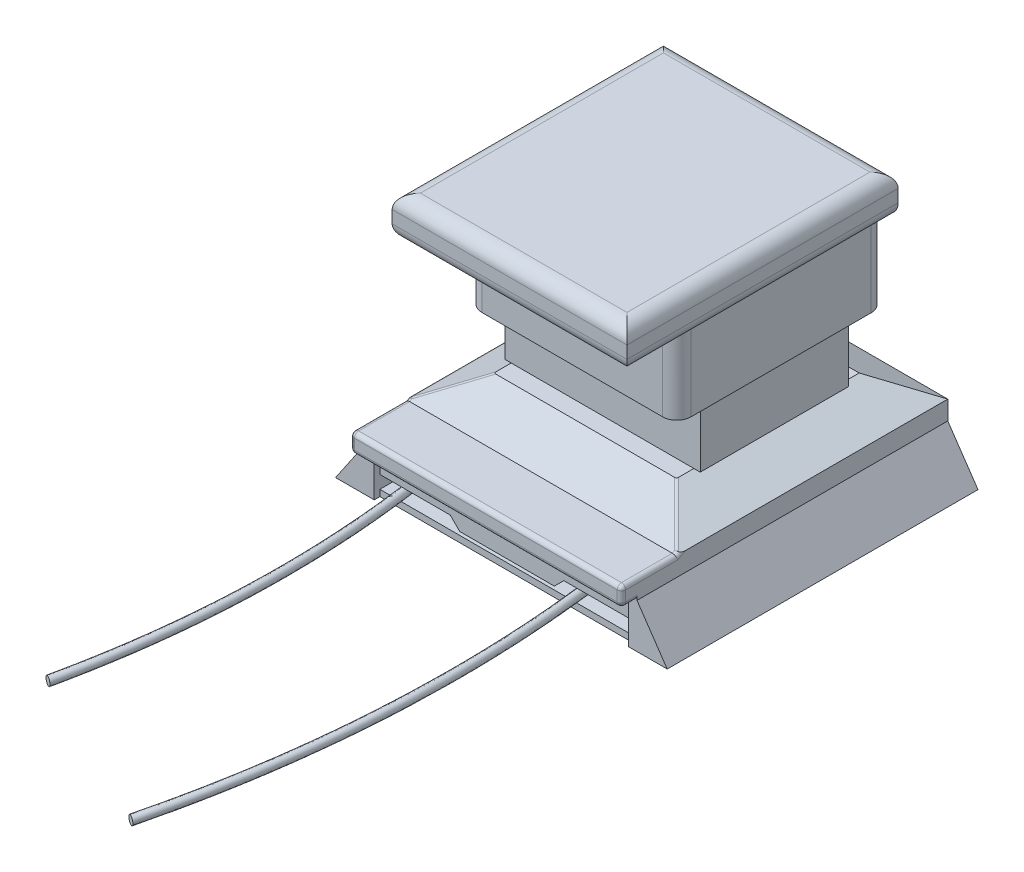
from build123d import *

# Parameters (mm, degrees)
SKETCH3_W            = 18.796
SKETCH3_H            = 18.7452
BOSS_EXTRUDE1_DEPTH  = 7.239
SKETCH4_W            = 21.1074
SKETCH4_H            = 24.384
BOSS_EXTRUDE2_DEPTH  = 3.6576
FILLET1_R            = 1.27
FILLET2_R            = 1.27
SKETCH5_W            = 17.5768
SKETCH5_H            = 13.3096
BOSS_EXTRUDE3_DEPTH  = 5.334
SKETCH13_W           = 24.384
SKETCH13_H           = 24.384
BOSS_EXTRUDE10_DEPTH = 2.032
SKETCH15_W           = 24.384
SKETCH15_H           = 29.337
BOSS_EXTRUDE11_DEPTH = 1.7018
BOSS_EXTRUDE12_DEPTH = 27.94
FILLET3_R            = 1.27
FILLET4_R            = 0.381
VARFILLET2_R         = 0.381
VARFILLET3_R         = 0.381
FILLET5_R            = 0.381
FILLET6_R            = 0.381
SKETCH18_W           = 11.43
SKETCH18_H           = 0.57213832
CUT_EXTRUDE1_DEPTH   = 0.508
CUT_EXTRUDE2_DEPTH   = 7.112
SKETCH19_R           = 0.381999098


with BuildPart() as part:
    # Sketch3 → Boss-Extrude1 (new body)
    with BuildSketch(Plane(origin=(0, 0, 0), x_dir=(1, 0, 0), z_dir=(0, 1, 0))):
        Rectangle(SKETCH3_W, SKETCH3_H)
    extrude(amount=BOSS_EXTRUDE1_DEPTH)

    # Sketch4 → Boss-Extrude2 (add)
    with BuildSketch(Plane(origin=(0, 7.239, 0), x_dir=(1, 0, 0), z_dir=(0, 1, 0))):
        with Locations((0, -2.8194)):
            Rectangle(SKETCH4_W, SKETCH4_H)
    extrude(amount=BOSS_EXTRUDE2_DEPTH)

    # Fillet1
    fillet1_edges = [part.edges().sort_by_distance(p)[0] for p in [
        (0, 10.8966, -9.3726),
        (10.5537, 10.8966, 2.8194),
        (0, 10.8966, 15.0114),
        (-10.5537, 10.8966, 2.8194),
    ]]
    fillet(fillet1_edges, radius=FILLET1_R)

    # Fillet2
    fillet2_edges = [part.edges().sort_by_distance(p)[0] for p in [
        (10.5537, 7.239, 2.8194),
        (-10.5537, 7.239, 2.8194),
        (0, 7.239, 15.0114),
    ]]
    fillet(fillet2_edges, radius=FILLET2_R)

    # Sketch5 → Boss-Extrude3 (add)
    with BuildSketch(Plane.XZ):
        Rectangle(SKETCH5_W, SKETCH5_H)
    extrude(amount=BOSS_EXTRUDE3_DEPTH)

    # Sketch13 → Boss-Extrude10 (add)
    with BuildSketch(Plane.XZ.offset(5.334)):
        Rectangle(SKETCH13_W, SKETCH13_H)
    extrude(amount=BOSS_EXTRUDE10_DEPTH)

    # Cut-Sweep1: sweep along a path in Sketch13<2>
    with BuildLine(Plane.XZ.offset(5.334)) as cut_sweep1_path:
        Line((-12.192, 12.192), (12.192, 12.192))
        Line((12.192, 12.192), (12.192, -12.192))
        Line((12.192, -12.192), (-12.192, -12.192))
        Line((-12.192, -12.192), (-12.192, 12.192))
    # Sketch14 → Cut-Sweep1 (sweep, cut)
    with BuildSketch(Plane(origin=(12.192, 0, 0), x_dir=(0, 0, -1), z_dir=(1, 0, 0))):
        Polygon((-12.192, -5.334), (-12.192, -7.366), (-8.210109474, -5.334), align=None)
    sweep(path=cut_sweep1_path.line, transition=Transition.RIGHT, mode=Mode.SUBTRACT)

    # Sketch15 → Boss-Extrude11 (add)
    with BuildSketch(Plane.XZ.offset(7.366)):
        with Locations((0, 2.4765)):
            Rectangle(SKETCH15_W, SKETCH15_H)
    extrude(amount=BOSS_EXTRUDE11_DEPTH)

    # Sketch16 → Boss-Extrude12 (add)
    with BuildSketch(Plane(origin=(0, 0, -12.192), x_dir=(-1, 0, 0), z_dir=(0, 0, -1))):
        Polygon((-12.192, -9.0678), (-14.9098, -13.05576178), (14.9098, -13.05576178), (12.192, -9.0678), align=None)
    extrude(amount=-BOSS_EXTRUDE12_DEPTH)

    # Fillet3
    fillet3_edges = [part.edges().sort_by_distance(p)[0] for p in [
        (-9.398, 3.622076979, 9.3726),
        (-9.398, 3.622076979, -9.3726),
        (9.398, 3.622076979, -9.3726),
        (9.398, 3.622076979, 9.3726),
    ]]
    fillet(fillet3_edges, radius=FILLET3_R)

    # Fillet4
    fillet4_edges = [part.edges().sort_by_distance(p)[0] for p in [
        (0, -7.366, 17.145),
    ]]
    fillet(fillet4_edges, radius=FILLET4_R)

    # VarFillet2
    varfillet2_edges = [part.edges().sort_by_distance(p)[0] for p in [
        (-12.192, -9.0678, 16.4465),
        (-12.192, -8.4074, 17.145),
        (0, -9.0678, 17.145),
    ]]
    fillet(varfillet2_edges, radius=VARFILLET2_R)

    # VarFillet3
    varfillet3_edges = [part.edges().sort_by_distance(p)[0] for p in [
        (12.192, -9.0678, 16.256),
    ]]
    fillet(varfillet3_edges, radius=VARFILLET3_R)

    # Fillet5
    fillet5_edges = [part.edges().sort_by_distance(p)[0] for p in [
        (-12.192, -7.366, 0),
        (-12.192, -7.5565, 12.565302237),
        (-10.201054737, -6.35, 10.201054737),
    ]]
    fillet(fillet5_edges, radius=FILLET5_R)

    # Fillet6
    fillet6_edges = [part.edges().sort_by_distance(p)[0] for p in [
        (10.201054737, -6.35, 10.201054737),
        (12.192, -7.5565, 12.565302237),
    ]]
    fillet(fillet6_edges, radius=FILLET6_R)

    # Sketch18 → Cut-Extrude1 (cut)
    with BuildSketch(Plane.XY.offset(15.748)):
        Polygon((0, -9.0678), (-11.43, -9.0678), (-11.43, -11.328362841), (-5.08, -11.328362841), (-5.08, -11.355465108), (-4.2545, -12.180965108), (0, -12.180965108), align=None)
        with Locations((-5.715, -12.76969262)):
            Rectangle(SKETCH18_W, SKETCH18_H)
    cut_extrude1 = extrude(amount=-CUT_EXTRUDE1_DEPTH, mode=Mode.SUBTRACT)

    # Sketch18<4> → Cut-Extrude2 (cut)
    with BuildSketch(Plane.XY.offset(15.748)):
        Polygon((-5.08, -11.328362841), (-11.43, -11.328362841), (-11.43, -12.48362346), (0, -12.48362346), (0, -12.180965108), (-4.2545, -12.180965108), (-5.08, -11.355465108), align=None)
    cut_extrude2 = extrude(amount=-CUT_EXTRUDE2_DEPTH, mode=Mode.SUBTRACT)

    # Mirror1: Cut-Extrude1, Cut-Extrude2 across plane
    add(cut_extrude1.mirror(Plane(origin=(0, 0, 0), x_dir=(0, 0, 1), z_dir=(1, 0, 0))), mode=Mode.SUBTRACT)
    add(cut_extrude2.mirror(Plane(origin=(0, 0, 0), x_dir=(0, 0, 1), z_dir=(1, 0, 0))), mode=Mode.SUBTRACT)

    # Sweep1: sweep along a curve in space
    with BuildLine() as sweep1_path:
        add(Edge.make_bspline(
            [(-10.668, -11.97562346, 8.636), (-6.891419762, -11.949709625, 27.019974292), (-11.43, -12.48362346, 45.078230647)],
            knots=[0, 0, 0, 1, 1, 1], degree=2))
    # Sketch19 → Sweep1 (sweep)
    with BuildSketch(Plane.XY.offset(8.636)):
        with Locations((-10.668, -11.97562346)):
            Circle(SKETCH19_R)
        with Locations((5.2705, -11.97562346)):
            Circle(SKETCH19_R)
    sweep(path=sweep1_path.line)


solid = part.part
